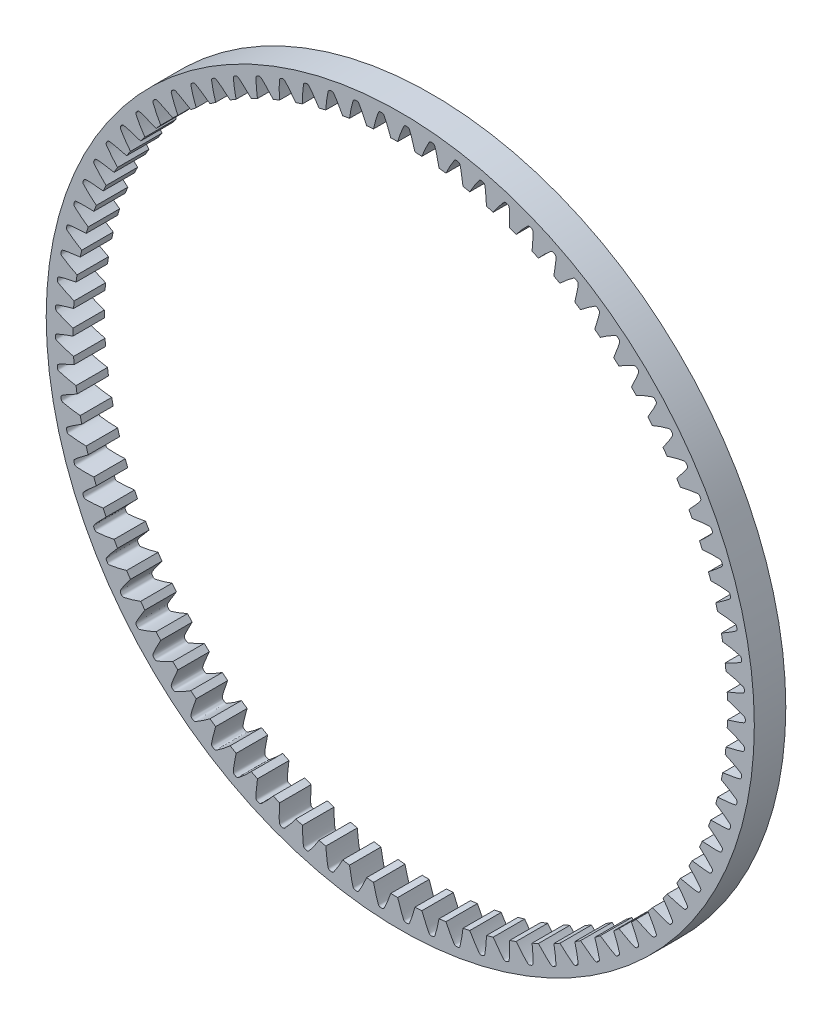
from build123d import *

# Parameters (mm, degrees)
SKETCHREVOLVESPURGEAR_W       = 4
SKETCHREVOLVESPURGEAR_H       = 3.400000623
TOOTHEXTRUDECUTSPURGEAR_DEPTH = 2
PATTERNSPURGEAR_COUNT         = 85


with BuildPart() as part:
    # SketchRevolveSpurGear → SpurGear (revolve)
    with BuildSketch(Plane(origin=(0, 0, 0), x_dir=(0, 0, -1), z_dir=(1, 0, 0))):
        with Locations((0, 43.299999689)):
            Rectangle(SKETCHREVOLVESPURGEAR_W, SKETCHREVOLVESPURGEAR_H)
    revolve(axis=Axis((0, 0, 0), (0, 0, -1)))

    # SketchToothSpurGear → ToothExtrudeCutSpurGear (cut, symmetric)
    with BuildSketch(Plane.XY):
        with BuildLine():
            ThreePointArc((41.552846843, -1.105624405), (41.567553285, 0), (41.552846843, 1.105624405))
            add(Edge.make_bspline(
                [(41.552846843, 1.105624405), (41.673284001, 1.074300745), (41.857727336, 1.023146139), (42.108058526, 0.947613855), (42.308408323, 0.883795769), (42.516686461, 0.813876573), (42.732829241, 0.737734764), (42.956380285, 0.654570034), (43.188408759, 0.566286412), (43.437520303, 0.458216502), (43.635660173, 0.396456981), (43.744485255, 0.319510011), (43.77556029, 0.28884056), (43.802033476, 0.254162276), (43.823120538, 0.215966349), (43.843700218, 0.162039666), (43.850916746, 0.103645766), (43.849772594, 0.045124008), (43.850112717, 0), (43.849772594, -0.045124008), (43.850916746, -0.103645766), (43.843700218, -0.162039666), (43.823120538, -0.215966349), (43.802033476, -0.254162276), (43.77556029, -0.28884056), (43.744485255, -0.319510011), (43.635660173, -0.396456981), (43.437520303, -0.458216502), (43.188408759, -0.566286412), (42.956380285, -0.654570034), (42.732829241, -0.737734764), (42.516686461, -0.813876573), (42.308408323, -0.883795769), (42.108058526, -0.947613855), (41.857727336, -1.023146139), (41.673284001, -1.074300745), (41.552846843, -1.105624405)],
                knots=[0, 0, 0, 0, 0.069600693, 0.107040471, 0.146239871, 0.187198892, 0.229917534, 0.274395798, 0.320633683, 0.368631189, 0.426700589, 0.434807445, 0.442914302, 0.451021158, 0.459128014, 0.46723487, 0.483178157, 0.491589083, 0.5, 0.508410917, 0.516821843, 0.53276513, 0.540871986, 0.548978842, 0.557085698, 0.565192555, 0.573299411, 0.631368811, 0.679366317, 0.725604202, 0.770082466, 0.812801108, 0.853760129, 0.892959529, 0.930399307, 1, 1, 1, 1], degree=3))
        make_face()
    toothextrudecutspurgear = extrude(amount=TOOTHEXTRUDECUTSPURGEAR_DEPTH, both=True, mode=Mode.SUBTRACT)

    # PatternSpurGear: ToothExtrudeCutSpurGear ×85 about axis
    patternspurgear_axis = Axis((0, 0, 55), (0, 0, -1))
    for i in range(1, PATTERNSPURGEAR_COUNT):
        add(toothextrudecutspurgear.rotate(patternspurgear_axis, i * 360 / PATTERNSPURGEAR_COUNT), mode=Mode.SUBTRACT)


solid = part.part
